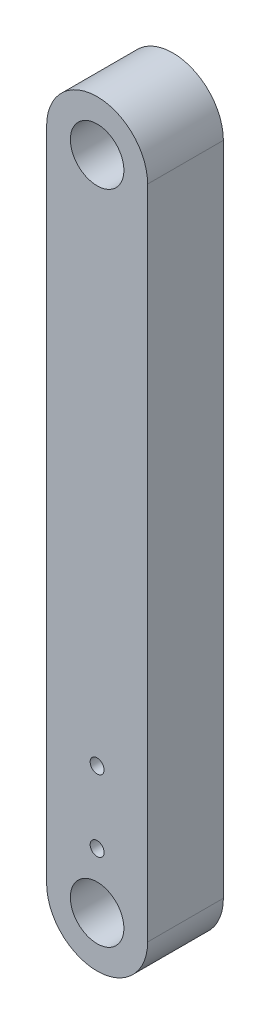
from build123d import *

# Parameters (mm, degrees)
SKETCH1_R           = 3.3655
BOSS_EXTRUDE1_DEPTH = 9.525
SKETCH2_R           = 0.877000024
CUT_EXTRUDE1_DEPTH  = 90.634023256


with BuildPart() as part:
    # Sketch1 → Boss-Extrude1 (new body)
    with BuildSketch(Plane.XY):
        with BuildLine():
            Line((-6.35, 0), (-6.35, 82.55))
            ThreePointArc((-6.35, 82.55), (0, 88.9), (6.35, 82.55))
            Line((6.35, 82.55), (6.35, 0))
            ThreePointArc((6.35, 0), (0, -6.35), (-6.35, 0))
        make_face()
        with Locations((0, 82.55)):
            Circle(SKETCH1_R, mode=Mode.SUBTRACT)
        Circle(SKETCH1_R, mode=Mode.SUBTRACT)
    extrude(amount=BOSS_EXTRUDE1_DEPTH)

    # Sketch2 → Cut-Extrude1 (cut, through all)
    with BuildSketch(Plane.XY.offset(9.525)):
        with Locations((0, 6.99999997)):
            Circle(SKETCH2_R)
        with Locations((0, 16.000000004)):
            Circle(SKETCH2_R)
    extrude(amount=-CUT_EXTRUDE1_DEPTH, mode=Mode.SUBTRACT)


solid = part.part
